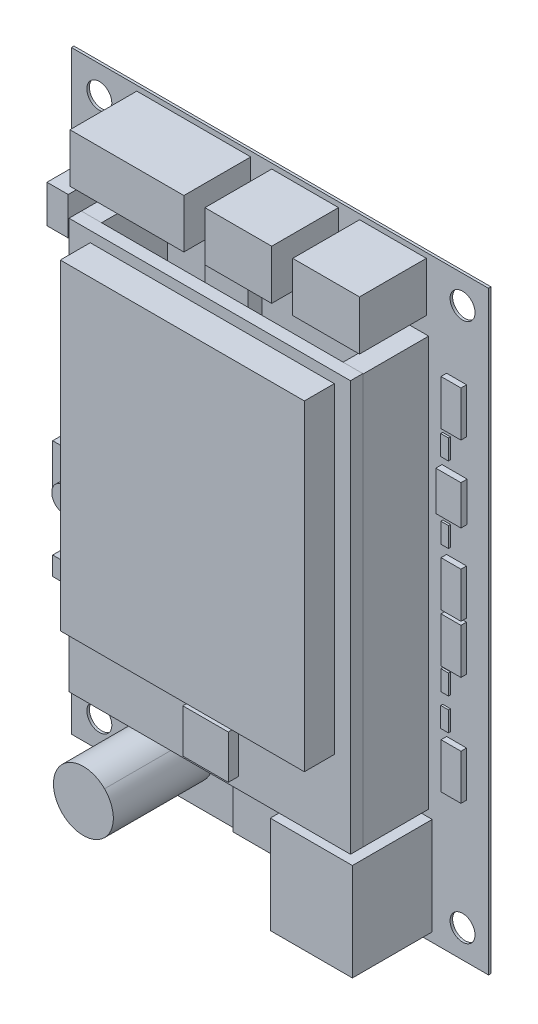
from build123d import *

# Parameters (mm, degrees)
SKETCH1_W                             = 53.086
SKETCH1_H                             = 75.692
BOARD_DEPTH                           = 0.32258
SKETCH3_W                             = 4.499864
SKETCH3_H                             = 10.200132
OS_SPDT_1_DEPTH                       = 3.96024277
SMA_50_TH_1_DEPTH                     = 12.7
SKETCH5_W                             = 4.010152
SKETCH5_H                             = 3.727196
U_FL_1_DEPTH                          = 1.27
SKETCH6_W                             = 10.700004
SKETCH6_H                             = 15.143988
DDPAK_1_DEPTH                         = 2.54
SKETCH7_W                             = 5.459476
SKETCH7_H                             = 7.380224
SOIC8_1_DEPTH                         = 1.7526
SKETCH8_W                             = 0.970026
SKETCH8_H                             = 2.54
EXTRUDE_0603_R_1_DEPTH                = 0.254
SKETCH9_W                             = 2.54
SKETCH9_H                             = 5.74802
F_0805_POL_1_DEPTH                    = 0.7112
SKETCH10_W                            = 0.970026
SKETCH10_H                            = 2.54
EXTRUDE_0603_R_2_DEPTH                = 0.254
SKETCH11_W                            = 0.970026
SKETCH11_H                            = 2.54
EXTRUDE_0603_R_3_DEPTH                = 0.254
SKETCH12_W                            = 2.54
SKETCH12_H                            = 5.74802
F_0805_POL_2_DEPTH                    = 0.7112
SKETCH13_W                            = 2.54
SKETCH13_H                            = 0.970026
EXTRUDE_0603_R_4_DEPTH                = 0.254
SKETCH14_W                            = 3.199892
SKETCH14_H                            = 5.000244
SOT505_2_1_DEPTH                      = 0.787911563
SKETCH15_W                            = 4.953
SKETCH15_H                            = 1.778
EXTRUDE_1206_R_1_DEPTH                = 0.635
SKETCH16_W                            = 0.970026
SKETCH16_H                            = 2.54
EXTRUDE_0603_R_5_DEPTH                = 0.254
SKETCH17_W                            = 2.54
SKETCH17_H                            = 0.970026
EXTRUDE_0603_R_6_DEPTH                = 0.254
SKETCH18_W                            = 0.970026
SKETCH18_H                            = 2.54
EXTRUDE_0603_R_7_DEPTH                = 0.254
SKETCH19_W                            = 0.970026
SKETCH19_H                            = 2.54
EXTRUDE_0603_R_8_DEPTH                = 0.254
SKETCH20_W                            = 4.953
SKETCH20_H                            = 1.778
EXTRUDE_1206_R_2_DEPTH                = 0.635
SKETCH21_W                            = 2.54
SKETCH21_H                            = 5.74802
F_0805_POL_3_DEPTH                    = 0.7112
SKETCH22_W                            = 2.54
SKETCH22_H                            = 5.74802
F_0805_POL_4_DEPTH                    = 0.7112
SKETCH23_W                            = 0.970026
SKETCH23_H                            = 2.54
EXTRUDE_0603_R_9_DEPTH                = 0.254
SKETCH24_W                            = 2.54
SKETCH24_H                            = 5.74802
F_0805_POL_5_DEPTH                    = 0.7112
SKETCH25_W                            = 14.499844
SKETCH25_H                            = 6.228588
HDR_SHERLOCK_6P_V_1_DEPTH             = 8.509
SKETCH26_W                            = 8.499856
SKETCH26_H                            = 6.304026
HDR_SHERLOCK_3P_V_1_DEPTH             = 8.509
SKETCH27_W                            = 8.499856
SKETCH27_H                            = 6.304026
HDR_SHERLOCK_3P_V_2_DEPTH             = 8.509
SKETCH28_W                            = 3.553968
SKETCH28_H                            = 2.898394
SOT_23_1_DEPTH                        = 1.0922
SKETCH29_W                            = 3.553968
SKETCH29_H                            = 2.898394
SOT_23_2_DEPTH                        = 1.0922
SKETCH30_W                            = 8.024114
SKETCH30_H                            = 6.199886
SPST_6MM_1_DEPTH                      = 3.556
SKETCH31_W                            = 2.54
SKETCH31_H                            = 0.970026
EXTRUDE_0603_R_10_DEPTH               = 0.254
SKETCH32_W                            = 2.54
SKETCH32_H                            = 0.970026
EXTRUDE_0603_R_11_DEPTH               = 0.254
SKETCH33_W                            = 1.778
SKETCH33_H                            = 4.953
EXTRUDE_1206_R_3_DEPTH                = 0.635
SKETCH34_W                            = 0.970026
SKETCH34_H                            = 2.54
EXTRUDE_0603_R_12_DEPTH               = 0.254
SKETCH35_W                            = 0.970026
SKETCH35_H                            = 2.54
EXTRUDE_0603_R_13_DEPTH               = 0.254
SKETCH36_W                            = 0.970026
SKETCH36_H                            = 2.54
EXTRUDE_0603_R_14_DEPTH               = 0.254
SKETCH37_W                            = 0.970026
SKETCH37_H                            = 2.54
EXTRUDE_0603_R_15_DEPTH               = 0.254
SKETCH38_W                            = 2.703576
SKETCH38_H                            = 4.797552
HDR_2P1R_100MIL_1_DEPTH               = 8.89
SKETCH39_W                            = 10.453878
SKETCH39_H                            = 12.399772
HDR_MFITJR_2R2P_V_1_DEPTH             = 10.16
SKETCH40_W                            = 5.69976
SKETCH40_H                            = 9.576816
SMC_R_1_DEPTH                         = 2.5146
F_1_8_0_125_DIAMETER_HOLE1_AT_2_COUNT = 2
F_1_8_0_125_DIAMETER_HOLE1_AT_2_PITCH = 46.228
F_1_8_0_125_DIAMETER_HOLE1_AT_3_COUNT = 2
F_1_8_0_125_DIAMETER_HOLE1_AT_3_PITCH = 68.58
F_1_8_0_125_DIAMETER_HOLE1_AT_4_COUNT = 2
F_1_8_0_125_DIAMETER_HOLE1_AT_4_PITCH = 82.705769956
FILLET2_R                             = 3.81
FILLET3_R                             = 3.81
SKETCH51_W                            = 2.570254887
SKETCH51_H                            = 52.141077617
EXTRUDE42_DEPTH                       = 8.382
SKETCH53_W                            = 2.570254886
SKETCH53_H                            = 52.141077618
EXTRUDE43_DEPTH                       = 8.382
SKETCH54_R                            = 1.596618618
EXTRUDE44_DEPTH                       = 2.54
SKETCH55_W                            = 2.191515438
SKETCH55_H                            = 2.376477694
EXTRUDE45_DEPTH                       = 2.54
SKETCH56_W                            = 35.821617123
SKETCH56_H                            = 52.201605854
EXTRUDE47_DEPTH                       = 1.5748
SKETCH58_W                            = 31.061808421
SKETCH58_H                            = 40.876665903
EXTRUDE48_DEPTH                       = 3.81
SKETCH59_W                            = 5.792142121
SKETCH59_H                            = 5.543382135
EXTRUDE49_DEPTH                       = 1.27


with BuildPart() as part:
    # Sketch1 → BOARD (new body)
    with BuildSketch(Plane.XY):
        with Locations((26.543, 37.846)):
            Rectangle(SKETCH1_W, SKETCH1_H)
    extrude(amount=BOARD_DEPTH)

    # Sketch45 → 1/8 (0.125) Diameter Hole1 (revolve, cut)
    with BuildSketch(Plane(origin=(3.556, 3.556, 0.32258), x_dir=(0, -1, 0), z_dir=(1, 0, 0))):
        Polygon((0, 0), (0, 26.353866233), (1.5875, 25.4), (1.5875, 0), align=None)
    f_1_8_0_125_diameter_hole1 = revolve(axis=Axis((3.556, 3.556, 6.67258), (0, 0, -1)), mode=Mode.SUBTRACT)

    # 1/8 (0.125) Diameter Hole1 at 2: 1/8 (0.125) Diameter Hole1 ×2
    with Locations(*[(i * F_1_8_0_125_DIAMETER_HOLE1_AT_2_PITCH, 0, 0) for i in range(1, F_1_8_0_125_DIAMETER_HOLE1_AT_2_COUNT)]):
        add(f_1_8_0_125_diameter_hole1, mode=Mode.SUBTRACT)

    # 1/8 (0.125) Diameter Hole1 at 3: 1/8 (0.125) Diameter Hole1 ×2
    with Locations(*[(0, i * F_1_8_0_125_DIAMETER_HOLE1_AT_3_PITCH, 0) for i in range(1, F_1_8_0_125_DIAMETER_HOLE1_AT_3_COUNT)]):
        add(f_1_8_0_125_diameter_hole1, mode=Mode.SUBTRACT)

    # 1/8 (0.125) Diameter Hole1 at 4: 1/8 (0.125) Diameter Hole1 ×2
    with Locations(*[Vector(0.558945283075698, 0.8292045408265851, 0) * (i * F_1_8_0_125_DIAMETER_HOLE1_AT_4_PITCH) for i in range(1, F_1_8_0_125_DIAMETER_HOLE1_AT_4_COUNT)]):
        add(f_1_8_0_125_diameter_hole1, mode=Mode.SUBTRACT)

    # Sketch51 → Extrude42 (add)
    with BuildSketch(Plane.XY.offset(0.32258)):
        with Locations((10.937127443, 40.604461192)):
            Rectangle(SKETCH51_W, SKETCH51_H)
    extrude(amount=EXTRUDE42_DEPTH)

    # Sketch53 → Extrude43 (add)
    with BuildSketch(Plane(origin=(33.059281334, 4.009991739, 0.32258), x_dir=(1, 0, 0), z_dir=(0, 0, 1))):
        with Locations((11.129208345, 36.533941215)):
            Rectangle(SKETCH53_W, SKETCH53_H)
    extrude(amount=EXTRUDE43_DEPTH)


with BuildPart() as body_2:
    # Sketch3 → OS_SPDT-1 (new body)
    with BuildSketch(Plane.XY.offset(0.32258)):
        with Locations((5.08, 21.418804)):
            Rectangle(SKETCH3_W, SKETCH3_H)
    extrude(amount=OS_SPDT_1_DEPTH)



with BuildPart() as body_3:
    # Sketch4 → SMA-50-TH-1 (new body)
    with BuildSketch(Plane.XY.offset(0.32258)):
        Polygon((19.612153673, 6.096), (14.224, 11.484153673), (8.835846327, 6.096), (14.224, 0.707846327), align=None)
    extrude(amount=SMA_50_TH_1_DEPTH)

    # Fillet2
    fillet2_edges = [body_3.edges().sort_by_distance(p)[0] for p in [
        (14.224, 0.707846327, 6.67258),
    ]]
    fillet(fillet2_edges, radius=FILLET2_R)

    # Fillet3
    fillet3_edges = [body_3.edges().sort_by_distance(p)[0] for p in [
        (8.835846327, 6.096, 6.67258),
        (14.224, 11.484153673, 6.67258),
        (19.612153673, 6.096, 6.67258),
    ]]
    fillet(fillet3_edges, radius=FILLET3_R - 0.0001)  # a hair under: the kernel refuses the full size


with BuildPart() as body_4:
    # Sketch5 → U_FL-1 (new body)
    with BuildSketch(Plane.XY.offset(0.32258)):
        with Locations((19.304, 12.539472)):
            Rectangle(SKETCH5_W, SKETCH5_H)
    extrude(amount=U_FL_1_DEPTH)


with BuildPart() as body_5:
    # Sketch6 → DDPAK-1 (new body)
    with BuildSketch(Plane.XY.offset(0.32258)):
        with Locations((28.448, 9.622028)):
            Rectangle(SKETCH6_W, SKETCH6_H)
    extrude(amount=DDPAK_1_DEPTH)


with BuildPart() as body_6:
    # Sketch7 → SOIC8-1 (new body)
    with BuildSketch(Plane.XY.offset(0.32258)):
        with Locations((21.500338, 59.182)):
            Rectangle(SKETCH7_W, SKETCH7_H)
    extrude(amount=SOIC8_1_DEPTH)


with BuildPart() as body_7:
    # Sketch8 → 0603-R-1 (new body)
    with BuildSketch(Plane.XY.offset(0.32258)):
        with Locations((9.139047, 22.606)):
            Rectangle(SKETCH8_W, SKETCH8_H)
    extrude(amount=EXTRUDE_0603_R_1_DEPTH)


with BuildPart() as body_8:
    # Sketch9 → 0805_POL-1 (new body)
    with BuildSketch(Plane.XY.offset(0.32258)):
        with Locations((49.022, 20.74799)):
            Rectangle(SKETCH9_W, SKETCH9_H)
    extrude(amount=F_0805_POL_1_DEPTH)


with BuildPart() as body_9:
    # Sketch10 → 0603-R-2 (new body)
    with BuildSketch(Plane.XY.offset(0.32258)):
        with Locations((47.747047, 25.654)):
            Rectangle(SKETCH10_W, SKETCH10_H)
    extrude(amount=EXTRUDE_0603_R_2_DEPTH)


with BuildPart() as body_10:
    # Sketch11 → 0603-R-3 (new body)
    with BuildSketch(Plane.XY.offset(0.32258)):
        with Locations((47.756953, 29.718)):
            Rectangle(SKETCH11_W, SKETCH11_H)
    extrude(amount=EXTRUDE_0603_R_3_DEPTH)


with BuildPart() as body_11:
    # Sketch12 → 0805_POL-2 (new body)
    with BuildSketch(Plane.XY.offset(0.32258)):
        with Locations((49.022, 34.62401)):
            Rectangle(SKETCH12_W, SKETCH12_H)
    extrude(amount=F_0805_POL_2_DEPTH)


with BuildPart() as body_12:
    # Sketch13 → 0603-R-4 (new body)
    with BuildSketch(Plane.XY.offset(0.32258)):
        with Locations((29.21, 20.070953)):
            Rectangle(SKETCH13_W, SKETCH13_H)
    extrude(amount=EXTRUDE_0603_R_4_DEPTH)


with BuildPart() as body_13:
    # Sketch14 → SOT505-2-1 (new body)
    with BuildSketch(Plane.XY.offset(0.32258)):
        with Locations((48.768, 50.8)):
            Rectangle(SKETCH14_W, SKETCH14_H)
    extrude(amount=SOT505_2_1_DEPTH)


with BuildPart() as body_14:
    # Sketch15 → 1206-R-1 (new body)
    with BuildSketch(Plane.XY.offset(0.32258)):
        with Locations((30.226, 22.098)):
            Rectangle(SKETCH15_W, SKETCH15_H)
    extrude(amount=EXTRUDE_1206_R_1_DEPTH)


with BuildPart() as body_15:
    # Sketch16 → 0603-R-5 (new body)
    with BuildSketch(Plane.XY.offset(0.32258)):
        with Locations((15.752953, 18.034)):
            Rectangle(SKETCH16_W, SKETCH16_H)
    extrude(amount=EXTRUDE_0603_R_5_DEPTH)


with BuildPart() as body_16:
    # Sketch17 → 0603-R-6 (new body)
    with BuildSketch(Plane.XY.offset(0.32258)):
        with Locations((27.686, 18.537047)):
            Rectangle(SKETCH17_W, SKETCH17_H)
    extrude(amount=EXTRUDE_0603_R_6_DEPTH)


with BuildPart() as body_17:
    # Sketch18 → 0603-R-7 (new body)
    with BuildSketch(Plane.XY.offset(0.32258)):
        with Locations((47.747047, 55.626)):
            Rectangle(SKETCH18_W, SKETCH18_H)
    extrude(amount=EXTRUDE_0603_R_7_DEPTH)


with BuildPart() as body_18:
    # Sketch19 → 0603-R-8 (new body)
    with BuildSketch(Plane.XY.offset(0.32258)):
        with Locations((47.756953, 45.974)):
            Rectangle(SKETCH19_W, SKETCH19_H)
    extrude(amount=EXTRUDE_0603_R_8_DEPTH)


with BuildPart() as body_19:
    # Sketch20 → 1206-R-2 (new body)
    with BuildSketch(Plane.XY.offset(0.32258)):
        with Locations((21.59, 53.34)):
            Rectangle(SKETCH20_W, SKETCH20_H)
    extrude(amount=EXTRUDE_1206_R_2_DEPTH)


with BuildPart() as body_20:
    # Sketch21 → 0805_POL-3 (new body)
    with BuildSketch(Plane.XY.offset(0.32258)):
        with Locations((49.022, 40.81399)):
            Rectangle(SKETCH21_W, SKETCH21_H)
    extrude(amount=F_0805_POL_3_DEPTH)


with BuildPart() as body_21:
    # Sketch22 → 0805_POL-4 (new body)
    with BuildSketch(Plane.XY.offset(0.32258)):
        with Locations((49.022, 60.78601)):
            Rectangle(SKETCH22_W, SKETCH22_H)
    extrude(amount=F_0805_POL_4_DEPTH)


with BuildPart() as body_22:
    # Sketch23 → 0603-R-9 (new body)
    with BuildSketch(Plane.XY.offset(0.32258)):
        with Locations((9.148953, 18.034)):
            Rectangle(SKETCH23_W, SKETCH23_H)
    extrude(amount=EXTRUDE_0603_R_9_DEPTH)


with BuildPart() as body_23:
    # Sketch24 → 0805_POL-5 (new body)
    with BuildSketch(Plane.XY.offset(0.32258)):
        with Locations((4.572, 9.57199)):
            Rectangle(SKETCH24_W, SKETCH24_H)
    extrude(amount=F_0805_POL_5_DEPTH)


with BuildPart() as body_24:
    # Sketch25 → HDR_SHERLOCK_6P_V-1 (new body)
    with BuildSketch(Plane.XY.offset(0.32258)):
        with Locations((15.57401, 71.925688)):
            Rectangle(SKETCH25_W, SKETCH25_H)
    extrude(amount=HDR_SHERLOCK_6P_V_1_DEPTH)


with BuildPart() as body_25:
    # Sketch26 → HDR_SHERLOCK_3P_V-1 (new body)
    with BuildSketch(Plane.XY.offset(0.32258)):
        with Locations((29.750004, 71.887969)):
            Rectangle(SKETCH26_W, SKETCH26_H)
    extrude(amount=HDR_SHERLOCK_3P_V_1_DEPTH)


with BuildPart() as body_26:
    # Sketch27 → HDR_SHERLOCK_3P_V-2 (new body)
    with BuildSketch(Plane.XY.offset(0.32258)):
        with Locations((40.926004, 71.887969)):
            Rectangle(SKETCH27_W, SKETCH27_H)
    extrude(amount=HDR_SHERLOCK_3P_V_2_DEPTH)


with BuildPart() as body_27:
    # Sketch28 → SOT-23-1 (new body)
    with BuildSketch(Plane.XY):
        with Locations((40.970962, 69.067299)):
            Rectangle(SKETCH28_W, SKETCH28_H)
    extrude(amount=-SOT_23_1_DEPTH)


with BuildPart() as body_28:
    # Sketch29 → SOT-23-2 (new body)
    with BuildSketch(Plane.XY):
        with Locations((29.794962, 69.067299)):
            Rectangle(SKETCH29_W, SKETCH29_H)
    extrude(amount=-SOT_23_2_DEPTH)


with BuildPart() as body_29:
    # Sketch30 → SPST_6MM-1 (new body)
    with BuildSketch(Plane.XY.offset(0.32258)):
        with Locations((5.182743, 31.611697)):
            Rectangle(SKETCH30_W, SKETCH30_H)
    extrude(amount=SPST_6MM_1_DEPTH)


    add(part.part)  # Extrude44 merges part
    # Sketch54 → Extrude44 (add)
    with BuildSketch(Plane.XY.offset(3.87858)):
        with Locations((5.189082854, 31.49392124)):
            Circle(SKETCH54_R)
    extrude(amount=EXTRUDE44_DEPTH)


with BuildPart() as body_30:
    # Sketch31 → 0603-R-10 (new body)
    with BuildSketch(Plane.XY.offset(0.32258)):
        with Locations((20.066, 64.511047)):
            Rectangle(SKETCH31_W, SKETCH31_H)
    extrude(amount=EXTRUDE_0603_R_10_DEPTH)


with BuildPart() as body_31:
    # Sketch32 → 0603-R-11 (new body)
    with BuildSketch(Plane.XY.offset(0.32258)):
        with Locations((23.114, 64.520953)):
            Rectangle(SKETCH32_W, SKETCH32_H)
    extrude(amount=EXTRUDE_0603_R_11_DEPTH)


with BuildPart() as body_32:
    # Sketch33 → 1206-R-3 (new body)
    with BuildSketch(Plane.XY.offset(0.32258)):
        with Locations((40.64, 51.816)):
            Rectangle(SKETCH33_W, SKETCH33_H)
    extrude(amount=EXTRUDE_1206_R_3_DEPTH)


with BuildPart() as body_33:
    # Sketch34 → 0603-R-12 (new body)
    with BuildSketch(Plane.XY):
        with Locations((12.603353, 69.2404)):
            Rectangle(SKETCH34_W, SKETCH34_H)
    extrude(amount=-EXTRUDE_0603_R_12_DEPTH)


with BuildPart() as body_34:
    # Sketch35 → 0603-R-13 (new body)
    with BuildSketch(Plane.XY):
        with Locations((18.597753, 69.2404)):
            Rectangle(SKETCH35_W, SKETCH35_H)
    extrude(amount=-EXTRUDE_0603_R_13_DEPTH)


with BuildPart() as body_35:
    # Sketch36 → 0603-R-14 (new body)
    with BuildSketch(Plane.XY):
        with Locations((14.584553, 69.2404)):
            Rectangle(SKETCH36_W, SKETCH36_H)
    extrude(amount=-EXTRUDE_0603_R_14_DEPTH)


with BuildPart() as body_36:
    # Sketch37 → 0603-R-15 (new body)
    with BuildSketch(Plane.XY):
        with Locations((16.565753, 69.2404)):
            Rectangle(SKETCH37_W, SKETCH37_H)
    extrude(amount=-EXTRUDE_0603_R_15_DEPTH)


with BuildPart() as body_37:
    # Sketch38 → HDR_2P1R_100MIL-1 (new body)
    with BuildSketch(Plane.XY.offset(0.32258)):
        with Locations((7.131812, 65.7733)):
            Rectangle(SKETCH38_W, SKETCH38_H)
    extrude(amount=HDR_2P1R_100MIL_1_DEPTH)


with BuildPart() as body_38:
    # Sketch39 → HDR_MFITJR_2R2P-V-1 (new body)
    with BuildSketch(Plane.XY.offset(0.32258)):
        with Locations((40.696007, 7.366)):
            Rectangle(SKETCH39_W, SKETCH39_H)
    extrude(amount=HDR_MFITJR_2R2P_V_1_DEPTH)


with BuildPart() as body_39:
    # Sketch40 → SMC-R-1 (new body)
    with BuildSketch(Plane.XY.offset(0.32258)):
        with Locations((37.033962, 17.762474)):
            Rectangle(SKETCH40_W, SKETCH40_H)
    extrude(amount=SMC_R_1_DEPTH)


with BuildPart() as body_2_1:
    add(body_2.part)

    add(body_29.part)  # Extrude45 merges body 29
    # Sketch55 → Extrude45 (add)
    with BuildSketch(Plane.XY.offset(4.28282277)):
        with Locations((5.216231246, 23.871638009)):
            Rectangle(SKETCH55_W, SKETCH55_H)
    extrude(amount=EXTRUDE45_DEPTH)


with BuildPart() as body_38_2:
    # Sketch56 → Extrude47 (new body)
    with BuildSketch(Plane.XY.offset(8.70458)):
        with Locations((27.562808562, 40.574197073)):
            Rectangle(SKETCH56_W, SKETCH56_H)
    extrude(amount=EXTRUDE47_DEPTH)

    # Sketch58 → Extrude48 (add)
    with BuildSketch(Plane.XY.offset(10.27938)):
        with Locations((27.886105411, 44.886485058)):
            Rectangle(SKETCH58_W, SKETCH58_H)
    extrude(amount=EXTRUDE48_DEPTH)

    # Sketch59 → Extrude49 (add)
    with BuildSketch(Plane.XY.offset(10.27938)):
        with Locations((28.303868165, 18.676232549)):
            Rectangle(SKETCH59_W, SKETCH59_H)
    extrude(amount=EXTRUDE49_DEPTH)


solid = Compound([body_3.part, body_4.part, body_5.part, body_6.part, body_7.part, body_8.part, body_9.part, body_10.part, body_11.part, body_12.part, body_13.part, body_14.part, body_15.part, body_16.part, body_17.part, body_18.part, body_19.part, body_20.part, body_21.part, body_22.part, body_23.part, body_24.part, body_25.part, body_26.part, body_27.part, body_28.part, body_30.part, body_31.part, body_32.part, body_33.part, body_34.part, body_35.part, body_36.part, body_37.part, body_38.part, body_39.part, body_2_1.part, body_38_2.part])
